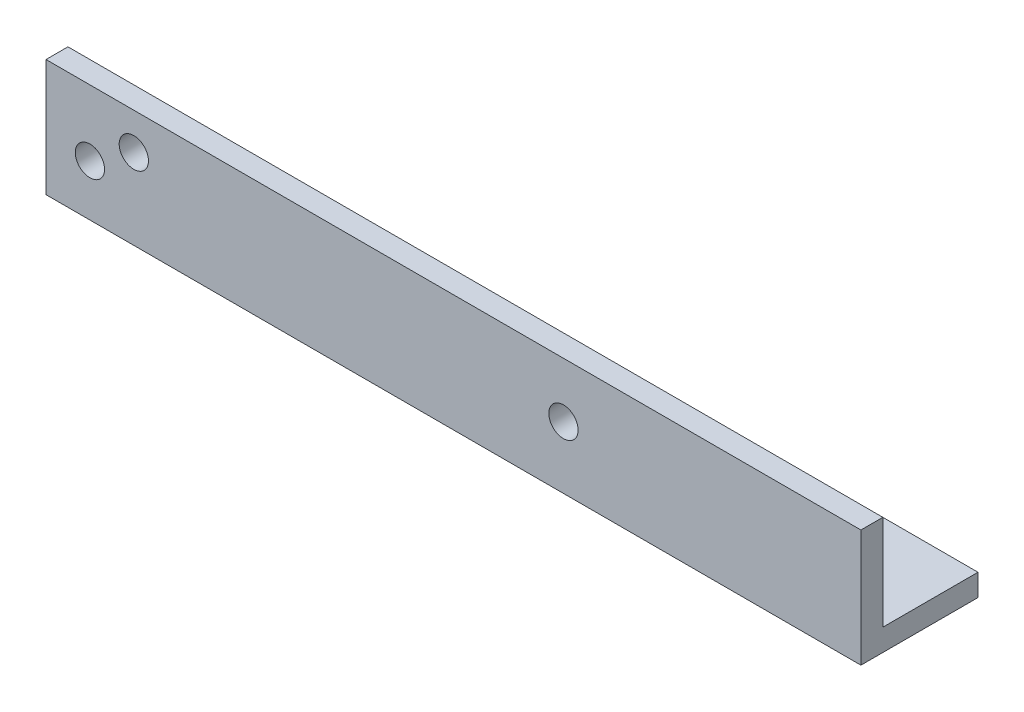
from build123d import *

# Parameters (mm, degrees)
BOSS_EXTRUDE1_DEPTH = 176.784
CUT_EXTRUDE1_REACH  = 181.788
SKETCH3_R           = 3.175
CUT_EXTRUDE2_REACH  = 182.397
SKETCH4_R           = 3.175
CUT_EXTRUDE4_REACH  = 182.397
SKETCH5_R           = 3.175


with BuildPart() as part:
    # Sketch1 → Boss-Extrude1 (new body)
    with BuildSketch(Plane(origin=(0, 0, 0), x_dir=(0, 0, -1), z_dir=(1, 0, 0))):
        Polygon((0, 0), (0, -25.4), (25.4, -25.4), (25.4, -20.6375), (4.7625, -20.6375), (4.7625, 0), align=None)
    extrude(amount=BOSS_EXTRUDE1_DEPTH)

    # Sketch3 → Cut-Extrude1 (cut, up to next)
    with BuildSketch(Plane(origin=(0, 0, -4.7625), x_dir=(-1, 0, 0), z_dir=(0, 0, -1)), mode=Mode.PRIVATE) as cut_extrude1_sk1:
        with Locations((-9.525, -14.2875)):
            Circle(SKETCH3_R)
    cut_extrude1_tool1 = extrude(cut_extrude1_sk1.sketch, amount=-CUT_EXTRUDE1_REACH, mode=Mode.PRIVATE) & part.part
    # Sketch3 → Cut-Extrude1 (cut, up to next)
    with BuildSketch(Plane(origin=(0, 0, -4.7625), x_dir=(-1, 0, 0), z_dir=(0, 0, -1)), mode=Mode.PRIVATE) as cut_extrude1_sk2:
        with Locations((-19.05, -7.9375)):
            Circle(SKETCH3_R)
    cut_extrude1_tool2 = extrude(cut_extrude1_sk2.sketch, amount=-CUT_EXTRUDE1_REACH, mode=Mode.PRIVATE) & part.part
    add(cut_extrude1_tool1.solids().sort_by_distance((9.525, -14.2875, -4.7625))[0], mode=Mode.SUBTRACT)
    add(cut_extrude1_tool2.solids().sort_by_distance((19.05, -7.9375, -4.7625))[0], mode=Mode.SUBTRACT)

    # Sketch4 → Cut-Extrude2 (cut, up to next)
    with BuildSketch(Plane.XY, mode=Mode.PRIVATE) as cut_extrude2_sk1:
        with Locations((112.253201513, -11.929615818)):
            Circle(SKETCH4_R)
    cut_extrude2_tool1 = extrude(cut_extrude2_sk1.sketch, amount=-CUT_EXTRUDE2_REACH, mode=Mode.PRIVATE) & part.part
    add(cut_extrude2_tool1.solids().sort_by_distance((112.253202, -11.929616, 0))[0], mode=Mode.SUBTRACT)

    # Sketch5 → Cut-Extrude4 (cut, up to next)
    with BuildSketch(Plane.XZ.offset(25.4), mode=Mode.PRIVATE) as cut_extrude4_sk1:
        with Locations((138.684, -12.7)):
            Circle(SKETCH5_R)
    cut_extrude4_tool1 = extrude(cut_extrude4_sk1.sketch, amount=-CUT_EXTRUDE4_REACH, mode=Mode.PRIVATE) & part.part
    # Sketch5 → Cut-Extrude4 (cut, up to next)
    with BuildSketch(Plane.XZ.offset(25.4), mode=Mode.PRIVATE) as cut_extrude4_sk2:
        with Locations((157.734, -12.7)):
            Circle(SKETCH5_R)
    cut_extrude4_tool2 = extrude(cut_extrude4_sk2.sketch, amount=-CUT_EXTRUDE4_REACH, mode=Mode.PRIVATE) & part.part
    add(cut_extrude4_tool1.solids().sort_by_distance((138.684, -25.4, -12.7))[0], mode=Mode.SUBTRACT)
    add(cut_extrude4_tool2.solids().sort_by_distance((157.734, -25.4, -12.7))[0], mode=Mode.SUBTRACT)


solid = part.part
